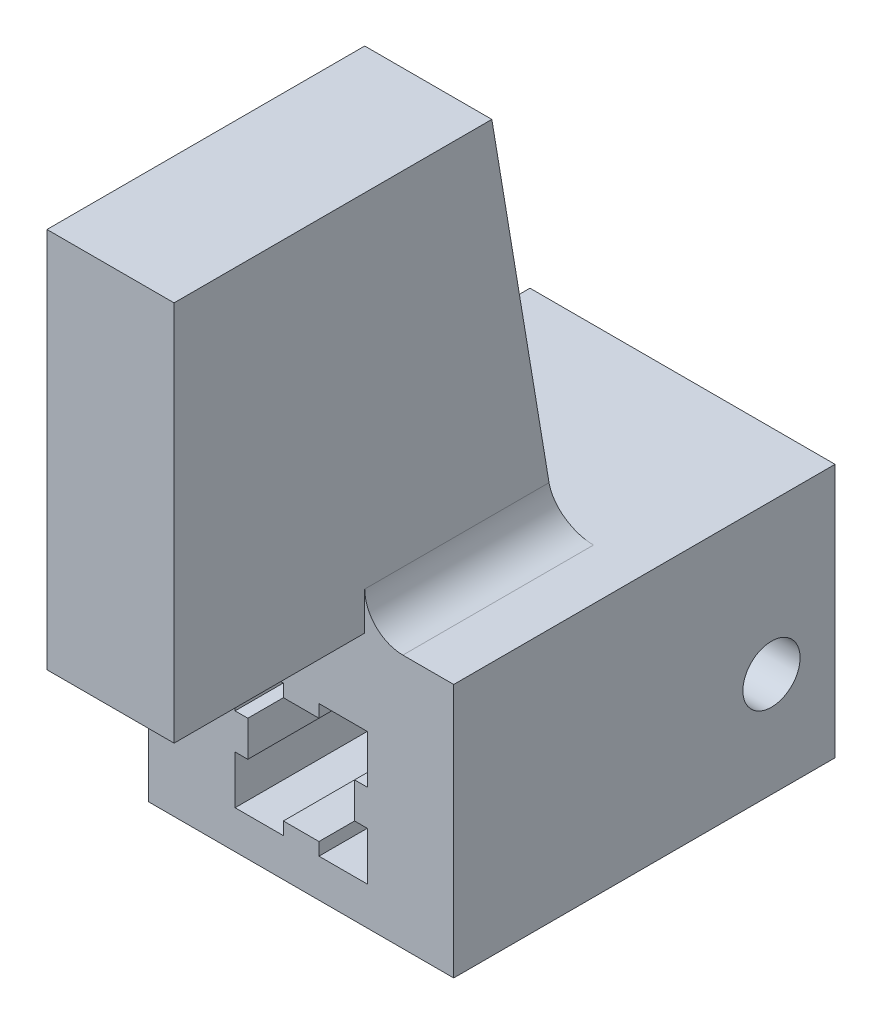
from build123d import *

# Parameters (mm, degrees)
ESQUISSE1_W            = 24
ESQUISSE1_H            = 20
MAIN_EXTRUSION_DEPTH   = 30
MAIN_RIDING_HOLE_DEPTH = 34.823069051
ESQUISSE4_R            = 2.25
TRACTORHOLE_DEPTH      = 8
IMPACTPIECE_DEPTH      = 5
CONG_1_R               = 3


with BuildPart() as part:
    # Esquisse1 → Main Extrusion (new body)
    with BuildSketch(Plane.XY):
        Rectangle(ESQUISSE1_W, ESQUISSE1_H)
    extrude(amount=MAIN_EXTRUSION_DEPTH)

    # Esquisse3 → Main Riding Hole (cut, through all)
    with BuildSketch(Plane(origin=(0, 0, 0), x_dir=(-1, 0, 0), z_dir=(0, 0, -1))):
        Polygon((-5.2, 3.4), (-5.2, -0.4), (-4.2, -0.4), (-4.2, -3.2), (-5.2, -3.2), (-5.2, -7), (-1.4, -7), (-1.4, -6), (1.4, -6), (1.4, -7), (5.2, -7), (5.2, -3.2), (4.2, -3.2), (4.2, -0.4), (5.2, -0.4), (5.2, 3.4), (1.4, 3.4), (1.4, 2.4), (-1.4, 2.4), (-1.4, 3.4), align=None)
    extrude(amount=-MAIN_RIDING_HOLE_DEPTH, mode=Mode.SUBTRACT)

    # Esquisse4 → TractorHole (cut)
    with BuildSketch(Plane.ZY.offset(12)):
        with Locations((5, -1.8)):
            Circle(ESQUISSE4_R)
    tractorhole = extrude(amount=-TRACTORHOLE_DEPTH, mode=Mode.SUBTRACT)

    # TractorHoleSymetry: TractorHole across plane
    add(tractorhole.mirror(Plane(origin=(0, 0, 0), x_dir=(0, 0, 1), z_dir=(1, 0, 0))), mode=Mode.SUBTRACT)

    # Esquisse5 → ImpactPiece (add, symmetric)
    with BuildSketch(Plane(origin=(0, 0, 0), x_dir=(0, 0, -1), z_dir=(1, 0, 0))):
        Polygon((-45, 10), (-45, 40), (-20, 40), (-15, 10), align=None)
    extrude(amount=IMPACTPIECE_DEPTH, both=True)

    # Congé1
    cong_1_edges = [part.edges().sort_by_distance(p)[0] for p in [
        (-5, 10, 22.5),
        (5, 10, 22.5),
    ]]
    fillet(cong_1_edges, radius=CONG_1_R)


solid = part.part
